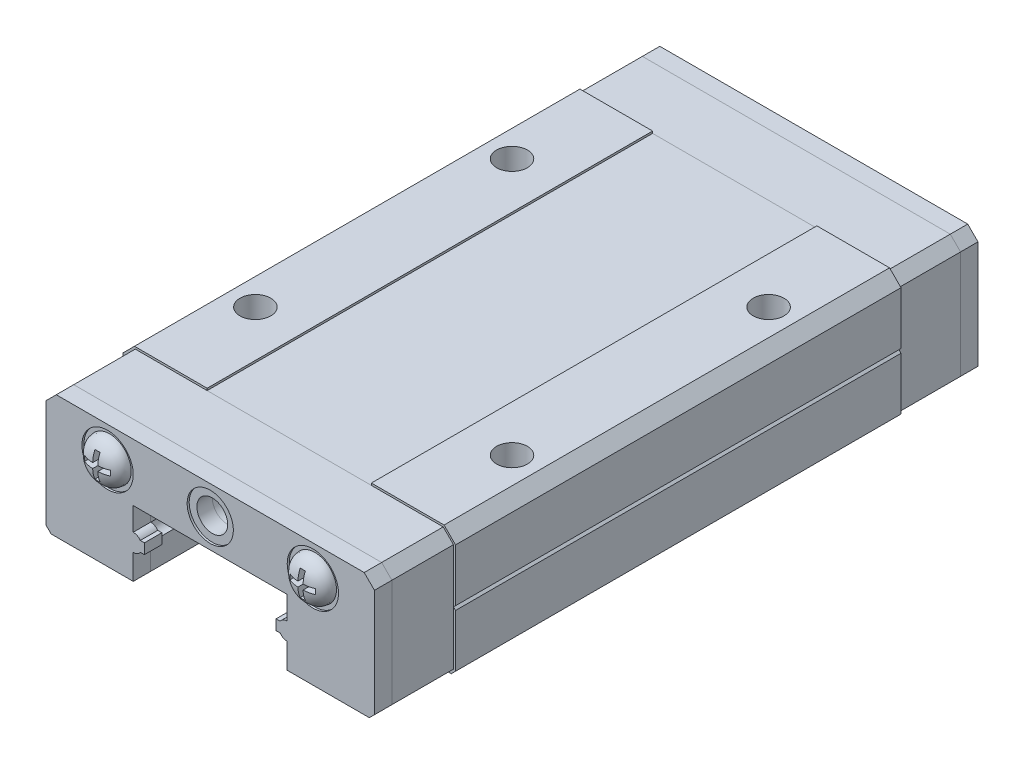
from build123d import *

# Parameters (mm, degrees)
BOSS_EXTRUDE1_DEPTH       = 1.7
BOSS_EXTRUDE2_DEPTH       = 6
BOSS_EXTRUDE3_DEPTH       = 43.4
BOSS_EXTRUDE4_DEPTH       = 6
BOSS_EXTRUDE5_DEPTH       = 1.7
CUT_EXTRUDE3_DEPTH        = 43.4
SKETCH8_W                 = 16
SKETCH8_H                 = 43.4
CUT_EXTRUDE4_DEPTH        = 0.2
SKETCH9_R                 = 1.5
CUT_EXTRUDE5_DEPTH        = 5.8
SKETCH10_R                = 2.5
SKETCH10_R_2              = 2.25
CUT_EXTRUDE6_DEPTH        = 0.2
SKETCH11_R                = 1.5
CUT_EXTRUDE7_DEPTH        = 5.8
SKETCH12_R                = 2.1
BOSS_EXTRUDE7_DEPTH       = 1.4
FILLET1_SIZE              = 1.4
FILLET1_SIZE_2            = 1.8
SKETCH14_W                = 0.5
SKETCH14_H                = 2.5
SKETCH14_W_2              = 2.5
SKETCH14_H_2              = 0.5
CUT_EXTRUDE8_DEPTH        = 1
FILLET1_OF_MIRROR2_SIZE   = 1.4
FILLET1_OF_MIRROR2_SIZE_2 = 1.8
SKETCH16_R                = 2.1
BOSS_EXTRUDE8_DEPTH       = 1.4
FILLET2_SIZE              = 1.4
FILLET2_SIZE_2            = 1.8
CUT_EXTRUDE9_DEPTH        = 1
FILLET2_OF_MIRROR7_SIZE   = 1.4
FILLET2_OF_MIRROR7_SIZE_2 = 1.8


with BuildPart() as part:
    # Sketch1 → Boss-Extrude1 (new body)
    with BuildSketch(Plane.XY):
        with BuildLine():
            Line((15, 6), (-15, 6))
            Line((-15, 6), (-16, 5))
            Line((-16, 5), (-16, -5.5))
            Line((-16, -5.5), (-15.5, -6))
            Line((-15.5, -6), (-7.5, -6))
            Line((-7.5, -6), (-7.5, -3.55))
            ThreePointArc((-7.5, -3.55), (-7.114318784, -3.45746287), (-6.812613646, -3.2))
            Line((-6.812613646, -3.2), (-6.412613646, -3.2))
            Line((-6.412613646, -3.2), (-6.412613646, -2.2))
            Line((-6.412613646, -2.2), (-6.812613646, -2.2))
            ThreePointArc((-6.812613646, -2.2), (-7.114318784, -1.94253713), (-7.5, -1.85))
            Line((-7.5, -1.85), (-7.5, 0.4))
            Line((-7.5, 0.4), (7.5, 0.4))
            Line((7.5, 0.4), (7.5, -1.85))
            ThreePointArc((7.5, -1.85), (7.114318784, -1.94253713), (6.812613646, -2.2))
            Line((6.812613646, -2.2), (6.412613646, -2.2))
            Line((6.412613646, -2.2), (6.412613646, -3.2))
            Line((6.412613646, -3.2), (6.812613646, -3.2))
            ThreePointArc((6.812613646, -3.2), (7.114318784, -3.45746287), (7.5, -3.55))
            Line((7.5, -3.55), (7.5, -6))
            Line((7.5, -6), (15.5, -6))
            Line((15.5, -6), (16, -5.5))
            Line((16, -5.5), (16, 5))
            Line((16, 5), (15, 6))
        make_face()
    extrude(amount=BOSS_EXTRUDE1_DEPTH)


with BuildPart() as body_2:
    # Sketch2 → Boss-Extrude2 (new body)
    with BuildSketch(Plane(origin=(0, 0, 0), x_dir=(-1, 0, 0), z_dir=(0, 0, -1))):
        with BuildLine():
            Line((-7.5, 0.4), (7.5, 0.4))
            Line((7.5, 0.4), (7.5, -1.85))
            ThreePointArc((7.5, -1.85), (8.101040764, -2.098959236), (8.35, -2.7))
            ThreePointArc((8.35, -2.7), (8.101040764, -3.301040764), (7.5, -3.55))
            Line((7.5, -3.55), (7.5, -6))
            Line((7.5, -6), (15.5, -6))
            Line((15.5, -6), (16, -5.5))
            Line((16, -5.5), (16, 5))
            Line((16, 5), (15, 6))
            Line((15, 6), (-15, 6))
            Line((-15, 6), (-16, 5))
            Line((-16, 5), (-16, -5.5))
            Line((-16, -5.5), (-15.5, -6))
            Line((-15.5, -6), (-7.5, -6))
            Line((-7.5, -6), (-7.5, -3.55))
            ThreePointArc((-7.5, -3.55), (-8.35, -2.7), (-7.5, -1.85))
            Line((-7.5, -1.85), (-7.5, 0.4))
        make_face()
    extrude(amount=BOSS_EXTRUDE2_DEPTH)


with BuildPart() as body_3:
    # Sketch3 → Boss-Extrude3 (new body)
    with BuildSketch(Plane(origin=(0, 0, -6), x_dir=(-1, 0, 0), z_dir=(0, 0, -1))):
        with BuildLine():
            Line((7.5, 0.4), (7.5, -1.85))
            ThreePointArc((7.5, -1.85), (8.35, -2.7), (7.5, -3.55))
            Line((7.5, -3.55), (7.5, -6))
            Line((7.5, -6), (15.5, -6))
            Line((15.5, -6), (16, -5.5))
            Line((16, -5.5), (16, 5))
            Line((16, 5), (15, 6))
            Line((15, 6), (-15, 6))
            Line((-15, 6), (-16, 5))
            Line((-16, 5), (-16, -5.5))
            Line((-16, -5.5), (-15.5, -6))
            Line((-15.5, -6), (-7.5, -6))
            Line((-7.5, -6), (-7.5, -3.55))
            ThreePointArc((-7.5, -3.55), (-8.35, -2.7), (-7.5, -1.85))
            Line((-7.5, -1.85), (-7.5, 0.4))
            Line((-7.5, 0.4), (7.5, 0.4))
        make_face()
        Polygon((-15.782842712, -6), (-15.5, -6), (-16, -5.5), (-16, 5), (-15, 6), (15, 6), (16, 5), (16, -5.5), (15.5, -6), (15.782842712, -6), (16.2, -5.582842712), (16.2, 5.082842712), (15.082842712, 6.2), (-15.082842712, 6.2), (-16.2, 5.082842712), (-16.2, -5.582842712), align=None)
    extrude(amount=BOSS_EXTRUDE3_DEPTH)

    # Sketch6 → Cut-Extrude3 (cut)
    with BuildSketch(Plane(origin=(0, 0, -49.4), x_dir=(-1, 0, 0), z_dir=(0, 0, -1))):
        Polygon((-16, -0.25), (-16.2, -0.05), (-16.2, -0.45), align=None)
    cut_extrude3 = extrude(amount=-CUT_EXTRUDE3_DEPTH, mode=Mode.SUBTRACT)

    # Sketch8 → Cut-Extrude4 (cut)
    with BuildSketch(Plane(origin=(0, 6.2, 0), x_dir=(1, 0, 0), z_dir=(0, 1, 0))):
        with Locations((0, 27.7)):
            Rectangle(SKETCH8_W, SKETCH8_H)
    extrude(amount=-CUT_EXTRUDE4_DEPTH, mode=Mode.SUBTRACT)

    # Mirror1: Cut-Extrude3 across plane
    add(cut_extrude3.mirror(Plane(origin=(0, 0, 0), x_dir=(0, 0, 1), z_dir=(1, 0, 0))), mode=Mode.SUBTRACT)

    # Sketch9 → Cut-Extrude5 (cut)
    with BuildSketch(Plane(origin=(0, 6.2, 0), x_dir=(1, 0, 0), z_dir=(0, 1, 0))):
        with Locations(Location((12.5, 40.2, 0), (0, 0, 180))):
            Circle(SKETCH9_R)
        with Locations(Location((-12.5, 40.2, 0), (0, 0, 180))):
            Circle(SKETCH9_R)
        with Locations(Location((-12.5, 15.2, 0), (0, 0, 180))):
            Circle(SKETCH9_R)
        with Locations(Location((12.5, 15.2, 0), (0, 0, 180))):
            Circle(SKETCH9_R)
    extrude(amount=-CUT_EXTRUDE5_DEPTH, mode=Mode.SUBTRACT)


with BuildPart() as body_4:
    # Sketch4 → Boss-Extrude4 (new body)
    with BuildSketch(Plane(origin=(0, 0, -49.4), x_dir=(-1, 0, 0), z_dir=(0, 0, -1))):
        with BuildLine():
            Line((7.5, 0.4), (7.5, -1.85))
            ThreePointArc((7.5, -1.85), (7.114318784, -1.94253713), (6.812613646, -2.2))
            Line((6.812613646, -2.2), (6.412613646, -2.2))
            Line((6.412613646, -2.2), (6.412613646, -3.2))
            Line((6.412613646, -3.2), (6.812613646, -3.2))
            ThreePointArc((6.812613646, -3.2), (7.114318784, -3.45746287), (7.5, -3.55))
            Line((7.5, -3.55), (7.5, -6))
            Line((7.5, -6), (15.5, -6))
            Line((15.5, -6), (16, -5.5))
            Line((16, -5.5), (16, 5))
            Line((16, 5), (15, 6))
            Line((15, 6), (-15, 6))
            Line((-15, 6), (-16, 5))
            Line((-16, 5), (-16, -5.5))
            Line((-16, -5.5), (-15.5, -6))
            Line((-15.5, -6), (-7.5, -6))
            Line((-7.5, -6), (-7.5, -3.55))
            ThreePointArc((-7.5, -3.55), (-7.114318784, -3.45746287), (-6.812613646, -3.2))
            Line((-6.812613646, -3.2), (-6.412613646, -3.2))
            Line((-6.412613646, -3.2), (-6.412613646, -2.2))
            Line((-6.412613646, -2.2), (-6.812613646, -2.2))
            ThreePointArc((-6.812613646, -2.2), (-7.114318784, -1.94253713), (-7.5, -1.85))
            Line((-7.5, -1.85), (-7.5, 0.4))
            Line((-7.5, 0.4), (7.5, 0.4))
        make_face()
    extrude(amount=BOSS_EXTRUDE4_DEPTH)


with BuildPart() as body_5:
    # Sketch5 → Boss-Extrude5 (new body)
    with BuildSketch(Plane(origin=(0, 0, -55.4), x_dir=(-1, 0, 0), z_dir=(0, 0, -1))):
        with BuildLine():
            Line((7.5, 0.4), (7.5, -1.85))
            ThreePointArc((7.5, -1.85), (7.114318784, -1.94253713), (6.812613646, -2.2))
            Line((6.812613646, -2.2), (6.412613646, -2.2))
            Line((6.412613646, -2.2), (6.412613646, -3.2))
            Line((6.412613646, -3.2), (6.812613646, -3.2))
            ThreePointArc((6.812613646, -3.2), (7.114318784, -3.45746287), (7.5, -3.55))
            Line((7.5, -3.55), (7.5, -6))
            Line((7.5, -6), (15.5, -6))
            Line((15.5, -6), (16, -5.5))
            Line((16, -5.5), (16, 5))
            Line((16, 5), (15, 6))
            Line((15, 6), (-15, 6))
            Line((-15, 6), (-16, 5))
            Line((-16, 5), (-16, -5.5))
            Line((-16, -5.5), (-15.5, -6))
            Line((-15.5, -6), (-7.5, -6))
            Line((-7.5, -6), (-7.5, -3.55))
            ThreePointArc((-7.5, -3.55), (-7.114318784, -3.45746287), (-6.812613646, -3.2))
            Line((-6.812613646, -3.2), (-6.412613646, -3.2))
            Line((-6.412613646, -3.2), (-6.412613646, -2.2))
            Line((-6.412613646, -2.2), (-6.812613646, -2.2))
            ThreePointArc((-6.812613646, -2.2), (-7.114318784, -1.94253713), (-7.5, -1.85))
            Line((-7.5, -1.85), (-7.5, 0.4))
            Line((-7.5, 0.4), (7.5, 0.4))
        make_face()
    extrude(amount=BOSS_EXTRUDE5_DEPTH)

    # Sketch10 → Cut-Extrude6 (cut)
    with BuildSketch(Plane(origin=(0, 0, -57.1), x_dir=(-1, 0, 0), z_dir=(0, 0, -1))):
        with Locations((-10, 3)):
            Circle(SKETCH10_R)
        with Locations((10, 3)):
            Circle(SKETCH10_R)
        with Locations((0, 3.2)):
            Circle(SKETCH10_R_2)
    cut_extrude6 = extrude(amount=-CUT_EXTRUDE6_DEPTH, mode=Mode.SUBTRACT)


with BuildPart() as cut_extrude7_tool:
    # Sketch11 → Cut-Extrude7 (new body)
    with BuildSketch(Plane(origin=(0, 0, -56.9), x_dir=(-1, 0, 0), z_dir=(0, 0, -1))):
        with Locations((0, 3.2)):
            Circle(SKETCH11_R)
    cut_extrude7 = extrude(amount=-CUT_EXTRUDE7_DEPTH)


with BuildPart() as body_4_1:
    add(body_4.part)

    # Cut-Extrude7: cut by cut_extrude7_tool
    add(cut_extrude7_tool.part, mode=Mode.SUBTRACT)


with BuildPart() as body_5_1:
    add(body_5.part)

    # Cut-Extrude7: cut by cut_extrude7_tool
    add(cut_extrude7_tool.part, mode=Mode.SUBTRACT)

    # Sketch12 → Boss-Extrude7 (add)
    with BuildSketch(Plane(origin=(0, 0, -56.9), x_dir=(-1, 0, 0), z_dir=(0, 0, -1))):
        with Locations((-10, 3)):
            Circle(SKETCH12_R)
    boss_extrude7 = extrude(amount=BOSS_EXTRUDE7_DEPTH)

    # Fillet1
    # an asymmetric fillet: 1.8, 1.4 mm, written as the material it takes off along each edge
    with BuildSketch(Plane(origin=(10, 3, -58.3), x_dir=(-1, 0, 0), z_dir=(0, -1, 0))) as fillet1_piece_1:
        with BuildLine():
            Bezier((2.1, -FILLET1_SIZE), (2.1, 0), (2.1 - FILLET1_SIZE_2, 0), weights=[1, 0.707106781, 1])
            Line((2.1 - FILLET1_SIZE_2, 0), (2.1, 0))
            Line((2.1, 0), (2.1, -FILLET1_SIZE))
        make_face()
    revolve(axis=Axis((10, 3, -58.3), (0, 0, -1)), mode=Mode.SUBTRACT)

    # Sketch14 → Cut-Extrude8 (cut)
    with BuildSketch(Plane(origin=(0, 0, -58.3), x_dir=(-1, 0, 0), z_dir=(0, 0, -1))):
        with Locations((-10, 3)):
            Rectangle(SKETCH14_W, SKETCH14_H)
        with Locations((-10, 3)):
            Rectangle(SKETCH14_W_2, SKETCH14_H_2)
    cut_extrude8 = extrude(amount=-CUT_EXTRUDE8_DEPTH, mode=Mode.SUBTRACT)

    # Mirror2: Boss-Extrude7, Cut-Extrude8 across plane
    add(boss_extrude7.mirror(Plane(origin=(0, 0, 0), x_dir=(0, 0, 1), z_dir=(1, 0, 0))))
    add(cut_extrude8.mirror(Plane(origin=(0, 0, 0), x_dir=(0, 0, 1), z_dir=(1, 0, 0))), mode=Mode.SUBTRACT)

    # Fillet1 of Mirror2
    # an asymmetric fillet: 1.8, 1.4 mm, written as the material it takes off along each edge
    with BuildSketch(Plane(origin=(-10, 3, -58.3), x_dir=(1, 0, 0), z_dir=(0, -1, 0))) as fillet1_of_mirror2_piece_1:
        with BuildLine():
            Bezier((2.1, FILLET1_OF_MIRROR2_SIZE), (2.1, 0), (2.1 - FILLET1_OF_MIRROR2_SIZE_2, 0), weights=[1, 0.707106781, 1])
            Line((2.1 - FILLET1_OF_MIRROR2_SIZE_2, 0), (2.1, 0))
            Line((2.1, 0), (2.1, FILLET1_OF_MIRROR2_SIZE))
        make_face()
    revolve(axis=Axis((-10, 3, -58.3), (0, 0, 1)), mode=Mode.SUBTRACT)


with BuildPart() as mirror3_tool:
    # Mirror3: Cut-Extrude6, Cut-Extrude7 across plane
    add(cut_extrude6.mirror(Plane(origin=(0, 0, -27.7), x_dir=(1, 0, 0), z_dir=(0, 0, -1))))
    add(cut_extrude7.mirror(Plane(origin=(0, 0, -27.7), x_dir=(1, 0, 0), z_dir=(0, 0, -1))))


with BuildPart() as part_1:
    add(part.part)

    # Mirror3: cut by mirror3_tool
    add(mirror3_tool.part, mode=Mode.SUBTRACT)

    # Sketch16 → Boss-Extrude8 (add)
    with BuildSketch(Plane.XY.offset(1.5)):
        with Locations((10, 3)):
            Circle(SKETCH16_R)
    boss_extrude8 = extrude(amount=BOSS_EXTRUDE8_DEPTH)

    # Fillet2
    # an asymmetric fillet: 1.8, 1.4 mm, written as the material it takes off along each edge
    with BuildSketch(Plane(origin=(10, 3, 2.9), x_dir=(1, 0, 0), z_dir=(0, -1, 0))) as fillet2_piece_1:
        with BuildLine():
            Bezier((2.1, -FILLET2_SIZE), (2.1, 0), (2.1 - FILLET2_SIZE_2, 0), weights=[1, 0.707106781, 1])
            Line((2.1 - FILLET2_SIZE_2, 0), (2.1, 0))
            Line((2.1, 0), (2.1, -FILLET2_SIZE))
        make_face()
    revolve(axis=Axis((10, 3, 2.9), (0, 0, 1)), mode=Mode.SUBTRACT)

    # Sketch17 → Cut-Extrude9 (cut)
    with BuildSketch(Plane.XY.offset(2.9)):
        Polygon((10.25, 3.25), (10.25, 4.25), (9.75, 4.25), (9.75, 3.25), (8.75, 3.25), (8.75, 2.75), (9.75, 2.75), (9.75, 1.75), (10.25, 1.75), (10.25, 2.75), (11.25, 2.75), (11.25, 3.25), align=None)
    cut_extrude9 = extrude(amount=-CUT_EXTRUDE9_DEPTH, mode=Mode.SUBTRACT)

    # Mirror7: Boss-Extrude8, Cut-Extrude9 across plane
    add(boss_extrude8.mirror(Plane(origin=(0, 0, 0), x_dir=(0, 0, 1), z_dir=(1, 0, 0))))
    add(cut_extrude9.mirror(Plane(origin=(0, 0, 0), x_dir=(0, 0, 1), z_dir=(1, 0, 0))), mode=Mode.SUBTRACT)

    # Fillet2 of Mirror7
    # an asymmetric fillet: 1.8, 1.4 mm, written as the material it takes off along each edge
    with BuildSketch(Plane(origin=(-10, 3, 2.9), x_dir=(-1, 0, 0), z_dir=(0, -1, 0))) as fillet2_of_mirror7_piece_1:
        with BuildLine():
            Bezier((2.1, FILLET2_OF_MIRROR7_SIZE), (2.1, 0), (2.1 - FILLET2_OF_MIRROR7_SIZE_2, 0), weights=[1, 0.707106781, 1])
            Line((2.1 - FILLET2_OF_MIRROR7_SIZE_2, 0), (2.1, 0))
            Line((2.1, 0), (2.1, FILLET2_OF_MIRROR7_SIZE))
        make_face()
    revolve(axis=Axis((-10, 3, 2.9), (0, 0, -1)), mode=Mode.SUBTRACT)


with BuildPart() as body_2_1:
    add(body_2.part)

    # Mirror3: cut by mirror3_tool
    add(mirror3_tool.part, mode=Mode.SUBTRACT)


solid = Compound([body_3.part, body_4_1.part, body_5_1.part, part_1.part, body_2_1.part])
